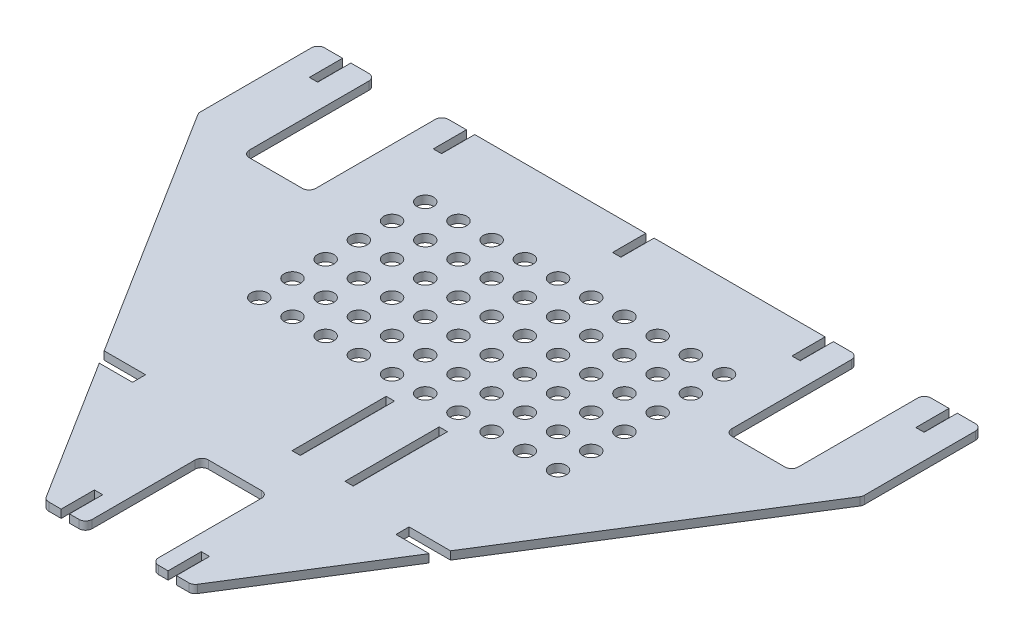
from build123d import *

# Parameters (mm, degrees)
BOSS_EXTRUDE1_DEPTH  = 3.0988
SKETCH2_W            = 3.175
SKETCH2_H            = 36.0426
CUT_EXTRUDE1_DEPTH   = 163.668873979
FILLET1_R            = 2.54
SKETCH3_R            = 3.175
CUT_EXTRUDE2_DEPTH   = 163.668873979
LPATTERN1_COUNT      = 10
LPATTERN1_PITCH      = 12.7
LPATTERN1_COUNT_DIR2 = 6
LPATTERN1_PITCH_DIR2 = 12.7
SKETCH4_W            = 15.847449194
SKETCH4_H            = 5.0165
SKETCH4_W_2          = 3.175
SKETCH4_H_2          = 12.7
CUT_EXTRUDE3_DEPTH   = 163.668873979


with BuildPart() as part:
    # Sketch1 → Boss-Extrude1 (new body)
    with BuildSketch(Plane(origin=(0, 0, 0), x_dir=(1, 0, 0), z_dir=(0, 1, 0))):
        Polygon((12.7, -57.15), (-12.7, -57.15), (-12.7, -101.6), (-18.8595, -101.6), (-18.8595, -88.9), (-22.0345, -88.9), (-22.0345, -101.6), (-28.194, -101.6), (-127, 55.88), (-127, 101.6), (-117.5893, 101.6), (-117.5893, 88.9), (-114.4143, 88.9), (-114.4143, 101.6), (-105.0036, 101.6), (-105.0036, 50.8), (-79.6036, 50.8), (-79.6036, 101.6), (-70.1929, 101.6), (-70.1929, 88.9), (-67.0179, 88.9), (-67.0179, 101.6), (67.0179, 101.6), (67.0179, 88.9), (70.1929, 88.9), (70.1929, 101.6), (79.6036, 101.6), (79.6036, 50.8), (105.0036, 50.8), (105.0036, 101.6), (114.4143, 101.6), (114.4143, 88.9), (117.5893, 88.9), (117.5893, 101.6), (127, 101.6), (127, 55.88), (28.194, -101.6), (22.0345, -101.6), (22.0345, -88.9), (18.8595, -88.9), (18.8595, -101.6), (12.7, -101.6), align=None)
    extrude(amount=BOSS_EXTRUDE1_DEPTH)

    # Sketch2 → Cut-Extrude1 (cut, through all)
    with BuildSketch(Plane(origin=(0, 3.0988, 0), x_dir=(1, 0, 0), z_dir=(0, 1, 0))):
        with Locations((4.3561, -20.0787)):
            Rectangle(SKETCH2_W, SKETCH2_H)
        with Locations((24.6253, -20.0787)):
            Rectangle(SKETCH2_W, SKETCH2_H)
    extrude(amount=-CUT_EXTRUDE1_DEPTH, mode=Mode.SUBTRACT)

    # Fillet1
    fillet1_edges = [part.edges().sort_by_distance(p)[0] for p in [
        (105.0036, 1.5494, -50.8),
        (105.0036, 1.5494, -101.6),
        (12.7, 1.5494, 101.6),
        (12.7, 1.5494, 57.15),
        (-12.7, 1.5494, 57.15),
        (-12.7, 1.5494, 101.6),
        (-127, 1.5494, -55.88),
        (-127, 1.5494, -101.6),
        (-105.0036, 1.5494, -101.6),
        (-105.0036, 1.5494, -50.8),
        (-79.6036, 1.5494, -50.8),
        (-79.6036, 1.5494, -101.6),
        (79.6036, 1.5494, -101.6),
        (79.6036, 1.5494, -50.8),
        (127, 1.5494, -101.6),
        (127, 1.5494, -55.88),
        (28.194, 1.5494, 101.6),
        (-28.194, 1.5494, 101.6),
    ]]
    fillet(fillet1_edges, radius=FILLET1_R)

    # Sketch3 → Cut-Extrude2 (cut, through all)
    with BuildSketch(Plane(origin=(0, 3.0988, 0), x_dir=(1, 0, 0), z_dir=(0, 1, 0))):
        with Locations((-54.2036, 69.85)):
            Circle(SKETCH3_R)
    cut_extrude2 = extrude(amount=-CUT_EXTRUDE2_DEPTH, mode=Mode.SUBTRACT)

    # LPattern1: Cut-Extrude2 10 × 6
    with Locations(*[(i * LPATTERN1_PITCH, 0, j * LPATTERN1_PITCH_DIR2) for i in range(LPATTERN1_COUNT) for j in range(LPATTERN1_COUNT_DIR2) if (i, j) != (0, 0)]):
        add(cut_extrude2, mode=Mode.SUBTRACT)

    # Sketch4 → Cut-Extrude3 (cut, through all)
    with BuildSketch(Plane(origin=(0, 3.0988, 0), x_dir=(1, 0, 0), z_dir=(0, 1, 0))):
        with Locations((58.328724597, -43.449539203)):
            Rectangle(SKETCH4_W, SKETCH4_H)
        with Locations((-58.328724597, -43.449539203)):
            Rectangle(SKETCH4_W, SKETCH4_H)
        with Locations((0, 95.25)):
            Rectangle(SKETCH4_W_2, SKETCH4_H_2)
    extrude(amount=-CUT_EXTRUDE3_DEPTH, mode=Mode.SUBTRACT)


solid = part.part
